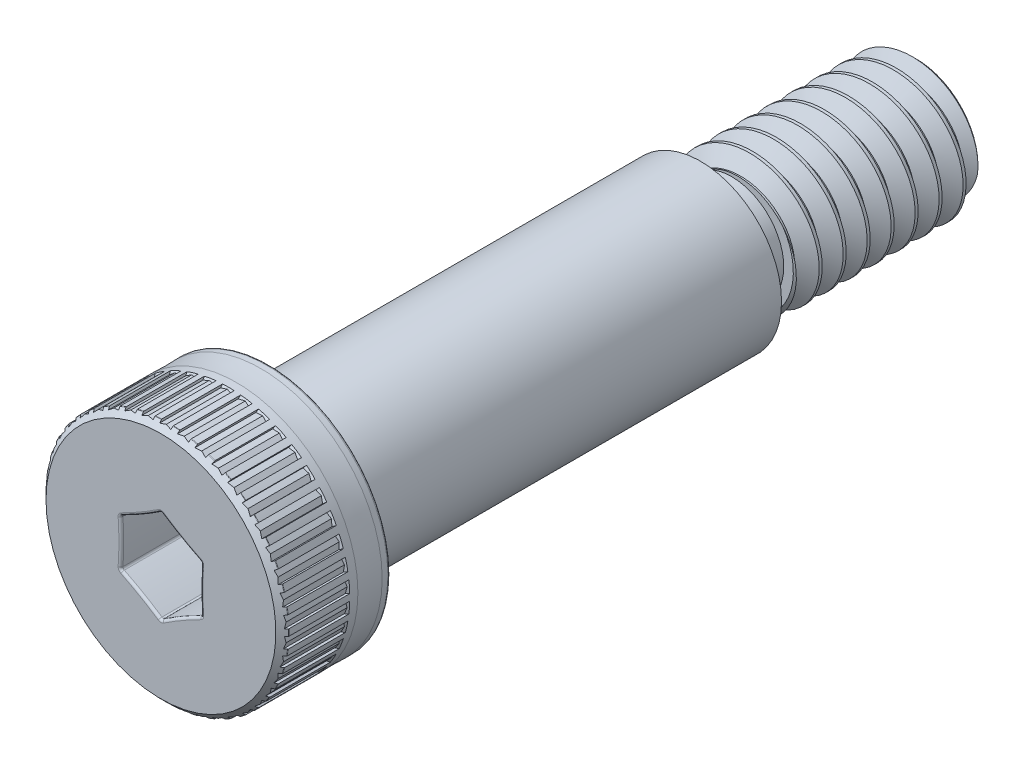
from build123d import *

# Parameters (mm, degrees)
SKETCH4_W             = 1.5875
SKETCH4_H             = 0.47625
SKETCH4_W_2           = 1.834444444
SKETCH4_H_2           = 0.916543552
CHAMFER1_SIZE         = 0.47625
FILLET1_R             = 0.28575
FILLET2_R             = 0.282222222
CHAMFER2_SIZE         = 0.352777778
CHAMFER3_SIZE         = 0.381
CUT_EXTRUDE1_DEPTH    = 3.9751
FILLET4_R             = 0.142875
DELETEFACE1_START     = -27.234444444
DELETEFACE1_OUTLINE_W = 10
DELETEFACE1_OUTLINE_H = 10
DELETEFACE1_OUTLINE_R = 3.058556448
DELETEFACE1_DEPTH     = 0.282222322
CUT_SWEEP1_PITCH      = 1.411111111
CUT_EXTRUDE2_REACH    = 47.584
CIRPATTERN1_COUNT     = 42
FILLET5_R             = 0.0508


# Read off the part's stored shape, not the designer's step: DeleteFace1, CirPattern2
with BuildPart() as part:
    # Sketch3 → Revolve1 (revolve)
    with BuildSketch(Plane(origin=(0, 0, 0), x_dir=(0, 0, -1), z_dir=(1, 0, 0)), mode=Mode.PRIVATE) as revolve1_sk:
        Polygon((-6.35, 7.14375), (0, 7.14375), (0, 4.7625), (25.4, 4.7625), (25.4, 3.9751), (38.1, 3.9751), (38.1, 0), (-6.35, 0), align=None)
    revolve(revolve1_sk.sketch.rotate(Axis((0, 0, 6.35), (0, 0, -1)), 90), axis=Axis((0, 0, 6.35), (0, 0, -1)))

    # Sketch4 → Cut-Revolve1 (revolve, cut)
    with BuildSketch(Plane(origin=(0, 0, 0), x_dir=(0, 0, -1), z_dir=(1, 0, 0)), mode=Mode.PRIVATE) as cut_revolve1_sk:
        with Locations((0.79375, 4.524375)):
            Rectangle(SKETCH4_W, SKETCH4_H)
        with Locations((26.317222222, 3.516828224)):
            Rectangle(SKETCH4_W_2, SKETCH4_H_2)
    revolve(cut_revolve1_sk.sketch.rotate(Axis((0, 0, 6.35), (0, 0, -1)), 90), axis=Axis((0, 0, 6.35), (0, 0, -1)), mode=Mode.SUBTRACT)

    # Chamfer1
    chamfer1_edges = [part.edges().sort_by_distance(p)[0] for p in [
        (-4.28625, 0, -1.5875),
    ]]
    chamfer(chamfer1_edges, length=CHAMFER1_SIZE - 0.0001)  # a hair under: the kernel refuses the full size

    # Fillet1
    fillet1_edges = [part.edges().sort_by_distance(p)[0] for p in [
        (-4.28625, 0, 0),
    ]]
    fillet(fillet1_edges, radius=FILLET1_R)

    # Fillet2
    fillet2_edges = [part.edges().sort_by_distance(p)[0] for p in [
        (-3.058556448, 0, -25.4),
        (-3.058556448, 0, -27.234444444),
    ]]
    fillet(fillet2_edges, radius=FILLET2_R)

    # Chamfer2
    chamfer2_edges = [part.edges().sort_by_distance(p)[0] for p in [
        (-3.9751, 0, -27.234444444),
        (-3.9751, 0, -38.1),
    ]]
    chamfer(chamfer2_edges, length=CHAMFER2_SIZE)

    # Chamfer3
    chamfer3_edges = [part.edges().sort_by_distance(p)[0] for p in [
        (-7.14375, 0, 6.35),
    ]]
    chamfer(chamfer3_edges, length=CHAMFER3_SIZE)

    # Sketch5 → Cut-Extrude1 (cut)
    with BuildSketch(Plane.XY.offset(6.35)):
        with BuildLine():
            ThreePointArc((2.38125, 1.374815329), (1.1668125, 2.020978533), (0, 2.749630657))
            ThreePointArc((0, 2.749630657), (-1.1668125, 2.020978533), (-2.38125, 1.374815329))
            ThreePointArc((-2.38125, 1.374815329), (-2.333625, 0), (-2.38125, -1.374815329))
            ThreePointArc((-2.38125, -1.374815329), (-1.1668125, -2.020978533), (0, -2.749630657))
            ThreePointArc((0, -2.749630657), (1.1668125, -2.020978533), (2.38125, -1.374815329))
            ThreePointArc((2.38125, -1.374815329), (2.333625, 0), (2.38125, 1.374815329))
        make_face()
    extrude(amount=-CUT_EXTRUDE1_DEPTH, mode=Mode.SUBTRACT)

    # Fillet4
    fillet4_edges = [part.edges().sort_by_distance(p)[0] for p in [
        (2.333625, 0, 2.3749),
        (2.38125, 1.374815329, 4.36245),
        (1.1668125, -2.020978533, 2.3749),
        (2.38125, -1.374815329, 4.36245),
        (-1.1668125, -2.020978533, 2.3749),
        (0, -2.749630657, 4.36245),
        (-2.333625, 0, 2.3749),
        (-2.38125, -1.374815329, 4.36245),
        (-1.1668125, 2.020978533, 2.3749),
        (-2.38125, 1.374815329, 4.36245),
        (1.1668125, 2.020978533, 2.3749),
        (0, 2.749630657, 4.36245),
        (2.333625, 0, 6.35),
        (1.1668125, 2.020978533, 6.35),
        (-1.1668125, 2.020978533, 6.35),
        (-2.333625, 0, 6.35),
        (-1.1668125, -2.020978533, 6.35),
        (1.1668125, -2.020978533, 6.35),
        (-7.14375, 0, 0),
    ]]
    fillet(fillet4_edges, radius=FILLET4_R)

    # DeleteFace1 outline → DeleteFace1 (cut)
    with BuildSketch(Plane.XY.offset(DELETEFACE1_START)):
        Rectangle(DELETEFACE1_OUTLINE_W, DELETEFACE1_OUTLINE_H)
        Circle(DELETEFACE1_OUTLINE_R, mode=Mode.SUBTRACT)
    extrude(amount=DELETEFACE1_DEPTH, mode=Mode.SUBTRACT)

    # Cut-Sweep1: the profile of Sketch7 profile screwed along a right-hand helix of 8.48 turns, 8 arcs to a turn; built about Z, then put on its axis
    cut_sweep1_z = Axis((0, 0, 0), (0, 0, 1))
    cut_sweep1_corners = [(4.051478629, 0, 0.044097222), (4.051478629, 0, -1.278819444), (3.058256448, 0, -0.70538235), (3.058256448, 0, -0.529339872)]
    with BuildLine(mode=Mode.PRIVATE) as cut_sweep1_profile:
        Line(cut_sweep1_corners[0], cut_sweep1_corners[1])
        Line(cut_sweep1_corners[1], cut_sweep1_corners[2])
        Line(cut_sweep1_corners[2], cut_sweep1_corners[3])
        Line(cut_sweep1_corners[3], cut_sweep1_corners[0])
    cut_sweep1_cap = Face(cut_sweep1_profile.wire())
    cut_sweep1_turn_angles = [0, 22.5, 45, 67.5, 90, 112.5, 135, 157.5, 180, 202.5, 225, 247.5, 270, 292.5, 315, 337.5, 360]
    cut_sweep1_turn_weights = [1, 0.9238795325112867, 1, 0.9238795325112867, 1, 0.9238795325112867, 1, 0.9238795325112867, 1, 0.9238795325112867, 1, 0.9238795325112867, 1, 0.9238795325112867, 1, 0.9238795325112867, 1]
    cut_sweep1_turn_rails = [Edge.make_bspline([Vector(p[0], p[1], 0).rotate(cut_sweep1_z, cut_sweep1_turn_angles[k]) / cut_sweep1_turn_weights[k] + Vector(0, 0, p[2] + CUT_SWEEP1_PITCH * cut_sweep1_turn_angles[k] / 360) for k in range(17)], [0, 0, 0, 1, 1, 2, 2, 3, 3, 4, 4, 5, 5, 6, 6, 7, 7, 8, 8, 8], 2, cut_sweep1_turn_weights) for p in cut_sweep1_corners]
    cut_sweep1_turn_sides = [Face.make_surface_from_curves(cut_sweep1_turn_rails[p[0]], cut_sweep1_turn_rails[p[1]]) for p in [(0, 1), (1, 2), (2, 3), (3, 0)]]
    cut_sweep1_last_angles = [2880, 2902.5, 2925, 2947.5, 2970, 2992.5, 3015, 3033.899999987, 3052.799999974]
    cut_sweep1_last_weights = [1, 0.9238795325112867, 1, 0.9238795325112867, 1, 0.9238795325112867, 1, 0.9460853589022572, 1]
    cut_sweep1_last_rails = [Edge.make_bspline([Vector(p[0], p[1], 0).rotate(cut_sweep1_z, cut_sweep1_last_angles[k]) / cut_sweep1_last_weights[k] + Vector(0, 0, p[2] + CUT_SWEEP1_PITCH * cut_sweep1_last_angles[k] / 360) for k in range(9)], [0, 0, 0, 1, 1, 2, 2, 3, 3, 4, 4, 4], 2, cut_sweep1_last_weights) for p in cut_sweep1_corners]
    cut_sweep1_last_sides = [Face.make_surface_from_curves(cut_sweep1_last_rails[p[0]], cut_sweep1_last_rails[p[1]]) for p in [(0, 1), (1, 2), (2, 3), (3, 0)]]
    cut_sweep1 = Plane(origin=(0, 0, -38.1), x_dir=(0, 1, 0), z_dir=(0, 0, 1)) * Solid(Shell([*[p.moved(Location((0, 0, CUT_SWEEP1_PITCH * i))) for i in range(8) for p in cut_sweep1_turn_sides], *cut_sweep1_last_sides, cut_sweep1_cap, cut_sweep1_cap.rotate(cut_sweep1_z, 3052.799999974).moved(Location((0, 0, CUT_SWEEP1_PITCH * 3052.799999974 / 360)))]))
    add(cut_sweep1, mode=Mode.SUBTRACT)

    # Cut-Extrude2: up to this plane
    cut_extrude2_end = Plane(origin=(0, 8.546915019, 0.978084981), z_dir=(0, 0.707106781186546, 0.7071067811865491))
    # Sketch8 → Cut-Extrude2 (cut, up to the surface)
    with BuildSketch(Plane.XY.offset(6.35), mode=Mode.PRIVATE) as cut_extrude2_sk1:
        Polygon((-0.3429, 7.14375), (0.3429, 7.14375), (0.328483903, 7.00659), (0, 7.07517), (-0.328483903, 7.00659), align=None)
    cut_extrude2_tool1 = split(extrude(cut_extrude2_sk1.sketch, amount=-CUT_EXTRUDE2_REACH, mode=Mode.PRIVATE), bisect_by=cut_extrude2_end, keep=Keep.BOTH, mode=Mode.PRIVATE)
    cut_extrude2 = cut_extrude2_tool1.solids().sort_by_distance((0, 7.090627, 6.35))[0]
    add(cut_extrude2, mode=Mode.SUBTRACT)

    # CirPattern1: Cut-Extrude2 ×42 about axis
    cirpattern1_axis = Axis((0, 0, 0), (0, 0, 1))
    for i in range(1, CIRPATTERN1_COUNT):
        add(cut_extrude2.rotate(cirpattern1_axis, i * 360 / CIRPATTERN1_COUNT), mode=Mode.SUBTRACT)

    # Fillet5
    fillet5_edges = [part.edges().sort_by_distance(p)[0] for p in [
        (0.533853106, 7.123774626, 5.969),
    ]]
    fillet(fillet5_edges, radius=FILLET5_R)

    # CirPattern2 outline → CirPattern2 (revolve, cut)
    with BuildSketch(Plane.XZ):
        with BuildLine():
            ThreePointArc((7.128871024, 5.983878976), (7.13988308, 5.96739827), (7.14375, 5.947957951))
            Line((7.14375, 5.947957951), (7.14375, 5.983878976))
            Line((7.14375, 5.983878976), (7.128871024, 5.983878976))
        make_face()
    revolve(axis=Axis((0, 0, 0), (0, 0, 1)), mode=Mode.SUBTRACT)

    # Sketch11 → Cut-Revolve6 (revolve, cut)
    with BuildSketch(Plane(origin=(0, 0, 0), x_dir=(0, 0, -1), z_dir=(1, 0, 0)), mode=Mode.PRIVATE) as cut_revolve6_sk:
        with BuildLine():
            Line((-1.905, 7.14375), (-0.47625, 7.14375))
            ThreePointArc((-0.47625, 7.14375), (-1.190625, 7.12597), (-1.905, 7.14375))
        make_face()
    revolve(cut_revolve6_sk.sketch.rotate(Axis((0, 0, 6.35), (0, 0, -1)), 90), axis=Axis((0, 0, 6.35), (0, 0, -1)), mode=Mode.SUBTRACT)


solid = part.part
